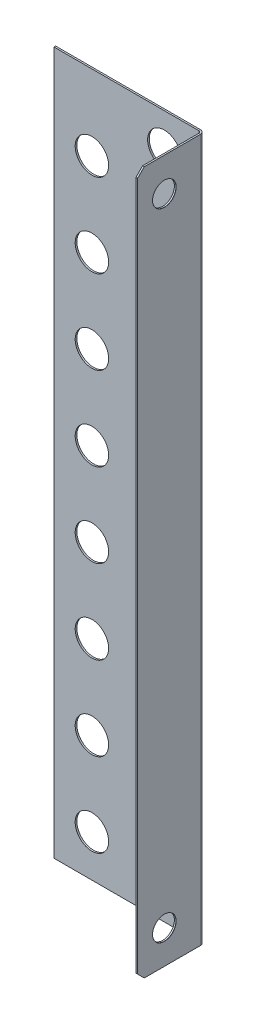
from build123d import *

# Parameters (mm, degrees)
SKETCH1_W                          = 44
SKETCH1_H                          = 210
BASE_FLANGE1_DEPTH                 = 0.5
SKETCH6_R                          = 5
CUT_EXTRUDE1_DEPTH                 = 10
LPATTERN1_COUNT                    = 8
LPATTERN1_PITCH                    = 25
EDGE_FLANGE2_STRIP_W               = 3.4732
EDGE_FLANGE2_STRIP_H               = 0.5
EDGE_FLANGE2_STRIP_CUT_DEPTH       = 210
EDGE_FLANGE2_DEPTH                 = 210
F_7_0_7_DIAMETER_HOLE2_D           = 7
F_7_0_7_DIAMETER_HOLE2_DEPTH       = 60
F_7_0_7_DIAMETER_HOLE2_CSINK_D     = 7.05
F_7_0_7_DIAMETER_HOLE2_CSINK_ANGLE = 90
F_7_0_7_DIAMETER_HOLE2_TIP         = 2.103012167
BREAK_CORNER2_START                = 22
BREAK_CORNER2_DEPTH                = 0.5


# Read off the part's stored shape, not the designer's step: Break-Corner2
# Sheet-metal steps are written as plain solids
with BuildPart() as part:
    # Sketch1 → Base-Flange1 (new body)
    with BuildSketch(Plane.XY):
        Rectangle(SKETCH1_W, SKETCH1_H)
    extrude(amount=-BASE_FLANGE1_DEPTH)

    # Sketch6 → Cut-Extrude1 (cut)
    with BuildSketch(Plane.XY):
        with Locations((11, 95)):
            Circle(SKETCH6_R)
        with Locations((-10.650635095, 82.5)):
            Circle(SKETCH6_R)
    cut_extrude1 = extrude(amount=-CUT_EXTRUDE1_DEPTH, mode=Mode.SUBTRACT)

    # LPattern1: Cut-Extrude1 ×8
    with Locations(*[(0, -i * LPATTERN1_PITCH, 0) for i in range(1, LPATTERN1_COUNT)]):
        add(cut_extrude1, mode=Mode.SUBTRACT)

    # Edge-Flange2 strip (across the edge) → Edge-Flange2 strip cut (cut)
    with BuildSketch(Plane(origin=(22, -105, 0), x_dir=(-1, 0, 0), z_dir=(0, 1, 0))):
        with Locations((-1, -0.25)):
            Rectangle(EDGE_FLANGE2_STRIP_W, EDGE_FLANGE2_STRIP_H)
    extrude(amount=EDGE_FLANGE2_STRIP_CUT_DEPTH, mode=Mode.SUBTRACT)

    # Edge-Flange2 section (across the edge) → Edge-Flange2 (add)
    with BuildSketch(Plane(origin=(22, -105, 0), x_dir=(-1, 0, 0), z_dir=(0, 1, 0))):
        with BuildLine():
            Line((-0.5, 0.7366), (-0.5, 19.5))
            Line((-0.5, 19.5), (0, 19.5))
            Line((0, 19.5), (0, 0.7366))
            ThreePointArc((0, 0.7366), (0.215745145, 0.215745145), (0.7366, 0))
            Line((0.7366, 0), (0.7366, -0.5))
            ThreePointArc((0.7366, -0.5), (-0.137808246, -0.137808246), (-0.5, 0.7366))
        make_face()
    extrude(amount=EDGE_FLANGE2_DEPTH)

    # Ø7.0 (7) Diameter Hole2
    with Locations(Plane(origin=(22.5, 0, 0), x_dir=(0, 0, -1), z_dir=(1, 0, 0))):
        with Locations((-11.5, 95), (-11.5, -95)):
            CounterSinkHole(F_7_0_7_DIAMETER_HOLE2_D / 2, F_7_0_7_DIAMETER_HOLE2_CSINK_D / 2, depth=F_7_0_7_DIAMETER_HOLE2_DEPTH, counter_sink_angle=F_7_0_7_DIAMETER_HOLE2_CSINK_ANGLE)
            with Locations((0, 0, -(F_7_0_7_DIAMETER_HOLE2_DEPTH + F_7_0_7_DIAMETER_HOLE2_TIP / 2))):  # 118° drill point
                Cone(0, F_7_0_7_DIAMETER_HOLE2_D / 2, F_7_0_7_DIAMETER_HOLE2_TIP, mode=Mode.SUBTRACT)

    # Break-Corner2 outline → Break-Corner2 (cut)
    with BuildSketch(Plane.YZ.offset(BREAK_CORNER2_START)):
        Polygon((-105, 19.5), (-105, 17.5), (-103, 19.5), align=None)
        Polygon((105, 19.5), (103, 19.5), (105, 17.5), align=None)
    extrude(amount=BREAK_CORNER2_DEPTH, mode=Mode.SUBTRACT)


solid = part.part
